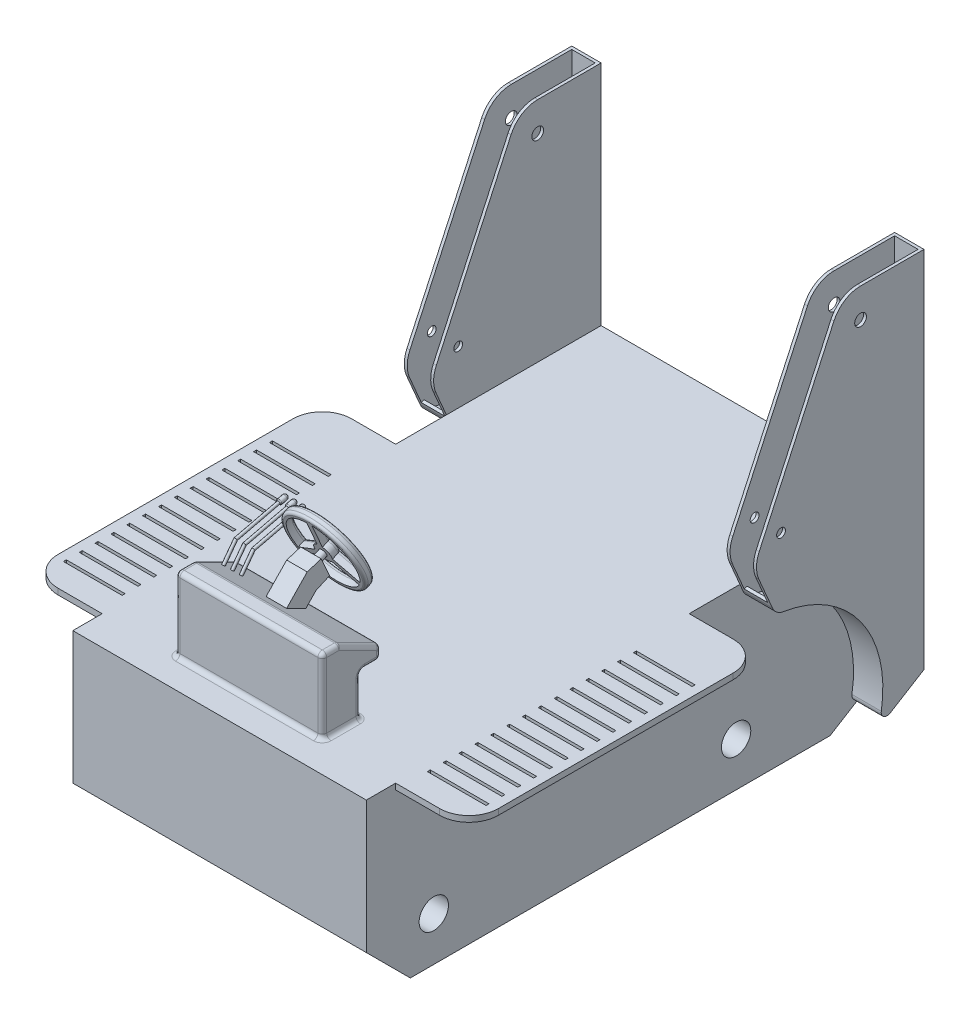
from build123d import *

# Parameters (mm, degrees)
SKETCH2_R            = 50
BOSS_EXTRUDE1_DEPTH  = 500
BOSS_EXTRUDE2_DEPTH  = 10
BOSS_EXTRUDE3_DEPTH  = 80
BOSS_EXTRUDE4_START  = 90
BOSS_EXTRUDE4_DEPTH  = 10
SKETCH6_R            = 20
SKETCH6_R_2          = 15
CUT_EXTRUDE1_DEPTH   = 2051.573090626
BOSS_EXTRUDE6_DEPTH  = 20
SKETCH8_W            = 200
SKETCH8_H            = 10
CUT_EXTRUDE2_DEPTH   = 1428.357698687
LPATTERN1_COUNT      = 14
LPATTERN1_PITCH      = 54
SKETCH9_W            = 500
SKETCH9_H            = 200
BOSS_EXTRUDE7_DEPTH  = 253
SKETCH10_W           = 70
SKETCH10_H           = 140
CUT_EXTRUDE3_DEPTH   = 1941.322138203
FILLET1_R            = 15
SKETCH13_R           = 5
SKETCH14_R           = 8.5
BOSS_EXTRUDE8_DEPTH  = 30
FILLET2_R            = 8.5
FILLET3_R            = 3.5
LPATTERN2_COUNT      = 3
LPATTERN2_PITCH      = 30
BOSS_EXTRUDE9_DEPTH  = 35
SKETCH17_R           = 12.5
BOSS_EXTRUDE10_DEPTH = 30
SKETCH18_R           = 135
BOSS_EXTRUDE11_DEPTH = 30
FILLET4_R            = 9
FILLET5_R            = 9


with BuildPart() as part:
    # Sketch2 → Boss-Extrude1 (new, symmetric)
    with BuildSketch(Plane(origin=(0, 0, 0), x_dir=(0, 0, -1), z_dir=(1, 0, 0))):
        Polygon((-865, 600), (935, 600), (935, 135), (715, 0), (-715, 0), (-865, 150), align=None)
        with Locations((-635, 150)):
            Circle(SKETCH2_R, mode=Mode.SUBTRACT)
        with Locations((395, 150)):
            Circle(SKETCH2_R, mode=Mode.SUBTRACT)
    extrude(amount=BOSS_EXTRUDE1_DEPTH, both=True)

    # Sketch7 → Boss-Extrude6 (add)
    with BuildSketch(Plane(origin=(0, 600, 0), x_dir=(1, 0, 0), z_dir=(0, 1, 0))):
        with BuildLine():
            Line((500, 235), (650, 235))
            ThreePointArc((650, 235), (720.710678119, 205.710678119), (750, 135))
            Line((750, 135), (750, -665))
            ThreePointArc((750, -665), (720.710678119, -735.710678119), (650, -765))
            Line((650, -765), (500, -765))
            Line((500, -765), (500, 235))
        make_face()
        with BuildLine():
            Line((-750, 135), (-750, -665))
            ThreePointArc((-750, -665), (-720.710678119, -735.710678119), (-650, -765))
            Line((-650, -765), (-500, -765))
            Line((-500, -765), (-500, 235))
            Line((-500, 235), (-650, 235))
            ThreePointArc((-650, 235), (-720.710678119, 205.710678119), (-750, 135))
        make_face()
    extrude(amount=-BOSS_EXTRUDE6_DEPTH)

    # Sketch8 → Cut-Extrude2 (cut, through all)
    with BuildSketch(Plane(origin=(0, 600, 0), x_dir=(1, 0, 0), z_dir=(0, 1, 0))):
        with Locations((620, 30)):
            Rectangle(SKETCH8_W, SKETCH8_H)
        with Locations((-620, 30)):
            Rectangle(SKETCH8_W, SKETCH8_H)
    cut_extrude2 = extrude(amount=-CUT_EXTRUDE2_DEPTH, mode=Mode.SUBTRACT)

    # LPattern1: Cut-Extrude2 ×14
    with Locations(*[(0, 0, i * LPATTERN1_PITCH) for i in range(1, LPATTERN1_COUNT)]):
        add(cut_extrude2, mode=Mode.SUBTRACT)

    # Sketch9 → Boss-Extrude7 (add)
    with BuildSketch(Plane(origin=(0, 600, 0), x_dir=(1, 0, 0), z_dir=(0, 1, 0))):
        with Locations((0, -665)):
            Rectangle(SKETCH9_W, SKETCH9_H)
    extrude(amount=BOSS_EXTRUDE7_DEPTH)

    # Sketch10 → Cut-Extrude3 (cut, through all)
    with BuildSketch(Plane(origin=(250, 0, 0), x_dir=(0, 0, -1), z_dir=(1, 0, 0))):
        Polygon((-705, 853), (-565, 853), (-565, 783), align=None)
        with Locations((-600, 670)):
            Rectangle(SKETCH10_W, SKETCH10_H)
    extrude(amount=-CUT_EXTRUDE3_DEPTH, mode=Mode.SUBTRACT)

    # Fillet1
    fillet1_edges = [part.edges().sort_by_distance(p)[0] for p in [
        (0, 600, 765),
        (-250, 726.5, 765),
        (250, 600, 700),
        (250, 726.5, 765),
        (0, 853, 765),
        (250, 853, 735),
        (-250, 853, 735),
        (0, 853, 705),
        (-250, 761.5, 565),
        (250, 761.5, 565),
        (0, 740, 565),
        (-250, 600, 700),
        (-250, 818, 635),
        (0, 783, 565),
        (250, 818, 635),
        (-250, 670, 635),
        (0, 600, 635),
        (-250, 740, 600),
        (0, 740, 635),
        (250, 740, 600),
        (250, 670, 635),
    ]]
    fillet(fillet1_edges, radius=FILLET1_R)

    # Sketch16 → Boss-Extrude9 (add, symmetric)
    with BuildSketch(Plane(origin=(0, 0, 0), x_dir=(0, 0, -1), z_dir=(1, 0, 0))):
        Polygon((-671.422291236, 836.211145618), (-601.351951882, 908.951420176), (-553.554880312, 923.629292957), (-525.367527322, 859.55532686), (-571.134645963, 839.421503296), (-605.822932772, 803.411466386), align=None)
    extrude(amount=BOSS_EXTRUDE9_DEPTH, both=True)

    # Sketch17 → Boss-Extrude10 (add)
    with BuildSketch(Plane(origin=(0, -54.268085161, 123.359275699), x_dir=(-1, 0, 0), z_dir=(0, 0.40267647128730943, -0.9153423728155496))):
        with Locations(Location((0, 1033.340554486, 0), (0, 0, 90))):
            Circle(SKETCH17_R)
    extrude(amount=BOSS_EXTRUDE10_DEPTH)

    # Sketch18 → Boss-Extrude11 (add)
    with BuildSketch(Plane(origin=(0, -42.187791022, 95.899004514), x_dir=(-1, 0, 0), z_dir=(0, 0.40267647128730943, -0.9153423728155496))):
        with Locations(Location((0, 1033.340554486, 0), (0, 0, 90))):
            Circle(SKETCH18_R)
        with BuildLine():
            Line((-9, 1149.993887057), (-9, 1061.958730528))
            ThreePointArc((-9, 1061.958730528), (-25.980762114, 1048.340554486), (-29.284067463, 1026.825695098))
            Line((-29.284067463, 1026.825695098), (-105.524749443, 982.808116834))
            ThreePointArc((-105.524749443, 982.808116834), (-101.324972243, 1091.840554486), (-9, 1149.993887057))
        make_face(mode=Mode.SUBTRACT)
        with BuildLine():
            Line((9, 1149.993887057), (9, 1061.958730528))
            ThreePointArc((9, 1061.958730528), (25.980762114, 1048.340554486), (29.284067463, 1026.825695098))
            Line((29.284067463, 1026.825695098), (105.524749443, 982.808116834))
            ThreePointArc((105.524749443, 982.808116834), (101.324972243, 1091.840554486), (9, 1149.993887057))
        make_face(mode=Mode.SUBTRACT)
        with BuildLine():
            Line((96.524749443, 967.219659566), (20.284067463, 1011.23723783))
            ThreePointArc((20.284067463, 1011.23723783), (0, 1003.340554486), (-20.284067463, 1011.23723783))
            Line((-20.284067463, 1011.23723783), (-96.524749443, 967.219659566))
            ThreePointArc((-96.524749443, 967.219659566), (0, 916.340554486), (96.524749443, 967.219659566))
        make_face(mode=Mode.SUBTRACT)
    extrude(amount=BOSS_EXTRUDE11_DEPTH)

    # Fillet4
    fillet4_edges = [part.edges().sort_by_distance(p)[0] for p in [
        (0, 792.181677856, 430.179337825),
        (0, 888.292627002, 472.46036731),
        (58.404408453, 875.375218605, 466.777754349),
        (0, 808.657840567, 437.427514308),
        (-58.404408453, 875.375218605, 466.777754349),
        (-25.980762114, 929.483033778, 490.580808518),
        (-67.404408453, 889.643994069, 473.054859314),
        (-101.324972243, 969.300426996, 508.097235019),
        (-9, 982.239481885, 513.789370682),
        (101.324972243, 969.300426996, 508.097235019),
        (67.404408453, 889.643994069, 473.054859314),
        (25.980762114, 929.483033778, 490.580808518),
        (9, 982.239481885, 513.789370682),
    ]]
    fillet(fillet4_edges, radius=FILLET4_R - 0.0001)  # a hair under: the kernel refuses the full size

    # Fillet5
    fillet5_edges = [part.edges().sort_by_distance(p)[0] for p in [
        (0, 780.101383717, 457.639609009),
    ]]
    fillet(fillet5_edges, radius=FILLET5_R)


with BuildPart() as body_2:
    # Sketch3 → Boss-Extrude2 (new body)
    with BuildSketch(Plane(origin=(500, 0, 0), x_dir=(0, 0, -1), z_dir=(1, 0, 0))):
        with BuildLine():
            Line((935, 135), (935, 1375))
            Line((935, 1375), (719.046420048, 1375))
            ThreePointArc((719.046420048, 1375), (665.113322029, 1359.20938747), (628.212957077, 1316.824418761))
            Line((628.212957077, 1316.824418761), (373.587493201, 763.833765708))
            ThreePointArc((373.587493201, 763.833765708), (364.429813626, 723.340291143), (372.50645317, 682.617417089))
            Line((372.50645317, 682.617417089), (418.67812534, 574.883515358))
            ThreePointArc((418.67812534, 574.883515358), (433.954375956, 555.099407026), (456.898112747, 545.181760255))
            ThreePointArc((456.898112747, 545.181760255), (719.23633033, 384.245175178), (789.622739752, 84.632628396))
            ThreePointArc((789.622739752, 84.632628396), (798.188752403, 64.770887689), (819.814201137, 64.317805243))
            Line((819.814201137, 64.317805243), (935, 135))
        make_face()
    extrude(amount=BOSS_EXTRUDE2_DEPTH)

    # Sketch5 → Boss-Extrude3 (add)
    with BuildSketch(Plane(origin=(510, 0, 0), x_dir=(0, 0, -1), z_dir=(1, 0, 0))):
        with BuildLine():
            Line((935, 135), (935, 1375))
            Line((935, 1375), (925, 1375))
            Line((925, 1375), (925, 140.596281363))
            Line((925, 140.596281363), (814.584038938, 72.84103253))
            ThreePointArc((814.584038938, 72.84103253), (803.771314571, 73.067573753), (799.488308246, 82.998444106))
            ThreePointArc((799.488308246, 82.998444106), (727.342238588, 390.101304558), (458.445565566, 555.061304261))
            ThreePointArc((458.445565566, 555.061304261), (440.090576133, 562.995421678), (427.86957564, 578.822708344))
            Line((427.86957564, 578.822708344), (421.819653651, 592.939192986))
            Line((421.819653651, 592.939192986), (412.628203351, 589))
            Line((412.628203351, 589), (418.67812534, 574.883515358))
            ThreePointArc((418.67812534, 574.883515358), (433.954375956, 555.099407026), (456.898112747, 545.181760255))
            ThreePointArc((456.898112747, 545.181760255), (719.23633033, 384.245175178), (789.622739752, 84.632628396))
            ThreePointArc((789.622739752, 84.632628396), (798.188752403, 64.770887689), (819.814201137, 64.317805243))
            Line((819.814201137, 64.317805243), (935, 135))
        make_face()
    extrude(amount=BOSS_EXTRUDE3_DEPTH)

    # Sketch3<2> → Boss-Extrude4 (add)
    with BuildSketch(Plane(origin=(500, 0, 0), x_dir=(0, 0, -1), z_dir=(1, 0, 0)).offset(BOSS_EXTRUDE4_START)):
        with BuildLine():
            Line((935, 135), (935, 1375))
            Line((935, 1375), (719.046420048, 1375))
            ThreePointArc((719.046420048, 1375), (665.113322029, 1359.20938747), (628.212957077, 1316.824418761))
            Line((628.212957077, 1316.824418761), (373.587493201, 763.833765708))
            ThreePointArc((373.587493201, 763.833765708), (364.429813626, 723.340291143), (372.50645317, 682.617417089))
            Line((372.50645317, 682.617417089), (418.67812534, 574.883515358))
            ThreePointArc((418.67812534, 574.883515358), (433.954375956, 555.099407026), (456.898112747, 545.181760255))
            ThreePointArc((456.898112747, 545.181760255), (719.23633033, 384.245175178), (789.622739752, 84.632628396))
            ThreePointArc((789.622739752, 84.632628396), (798.188752403, 64.770887689), (819.814201137, 64.317805243))
            Line((819.814201137, 64.317805243), (935, 135))
        make_face()
    extrude(amount=BOSS_EXTRUDE4_DEPTH)


with BuildPart() as body_3:
    # Mirror7: mirrored copy
    add(body_2.part.mirror(Plane(origin=(0, 0, 0), x_dir=(0, 0, 1), z_dir=(1, 0, 0))))


with BuildPart() as cut_extrude1_tool:
    # Sketch6 → Cut-Extrude1 (new, through all)
    with BuildSketch(Plane(origin=(600, 0, 0), x_dir=(0, 0, -1), z_dir=(1, 0, 0))):
        with Locations((719.046420048, 1275)):
            Circle(SKETCH6_R)
        with Locations((448.011421342, 782.009346947)):
            Circle(SKETCH6_R_2)
    extrude(amount=-CUT_EXTRUDE1_DEPTH)


with BuildPart() as body_2_1:
    add(body_2.part)

    # Cut-Extrude1: cut by cut_extrude1_tool
    add(cut_extrude1_tool.part, mode=Mode.SUBTRACT)


with BuildPart() as body_3_1:
    add(body_3.part)

    # Cut-Extrude1: cut by cut_extrude1_tool
    add(cut_extrude1_tool.part, mode=Mode.SUBTRACT)


with BuildPart() as body_4:
    # Sweep1: sweep along a path in Sketch12
    with BuildLine(Plane.ZY.offset(220)) as sweep1_path:
        Line((631.547682167, 816.273841083), (589.846227416, 872.496511525))
        Line((589.846227416, 872.496511525), (443.951076789, 907.347695489))
    # Sketch13 → Sweep1 (sweep)
    with BuildSketch(Plane(origin=(-220, 907.347695489, 443.951076789), x_dir=(-1, 0, 0), z_dir=(0, 0.23234122642147528, -0.9726343375107446))):
        Circle(SKETCH13_R)
    sweep(path=sweep1_path.line, transition=Transition.RIGHT)

    # Sketch14 → Boss-Extrude8 (add)
    with BuildSketch(Plane(origin=(-220, 907.347695489, 443.951076789), x_dir=(-1, 0, 0), z_dir=(0, 0.23234122642147528, -0.9726343375107446))):
        with Locations(Location((0, 0, 0), (0, 0, 90))):
            Circle(SKETCH14_R)
    extrude(amount=BOSS_EXTRUDE8_DEPTH)

    # Fillet2
    fillet2_edges = [body_4.edges().sort_by_distance(p)[0] for p in [
        (-220, 906.050540412, 412.797146239),
    ]]
    fillet(fillet2_edges, radius=FILLET2_R)

    # Fillet3
    fillet3_edges = [body_4.edges().sort_by_distance(p)[0] for p in [
        (-220, 899.08030362, 441.976176364),
    ]]
    fillet(fillet3_edges, radius=FILLET3_R - 0.0001)  # a hair under: the kernel refuses the full size


with BuildPart() as lpattern2_1:
    # LPattern2: pattern copy
    add(body_4.part.moved(Location(Vector(1, 0, 0) * (1 * LPATTERN2_PITCH))))


with BuildPart() as lpattern2_2:
    # LPattern2: pattern copy
    add(body_4.part.moved(Location(Vector(1, 0, 0) * (2 * LPATTERN2_PITCH))))


solid = Compound([part.part, body_2_1.part, body_3_1.part, body_4.part, lpattern2_1.part, lpattern2_2.part])
